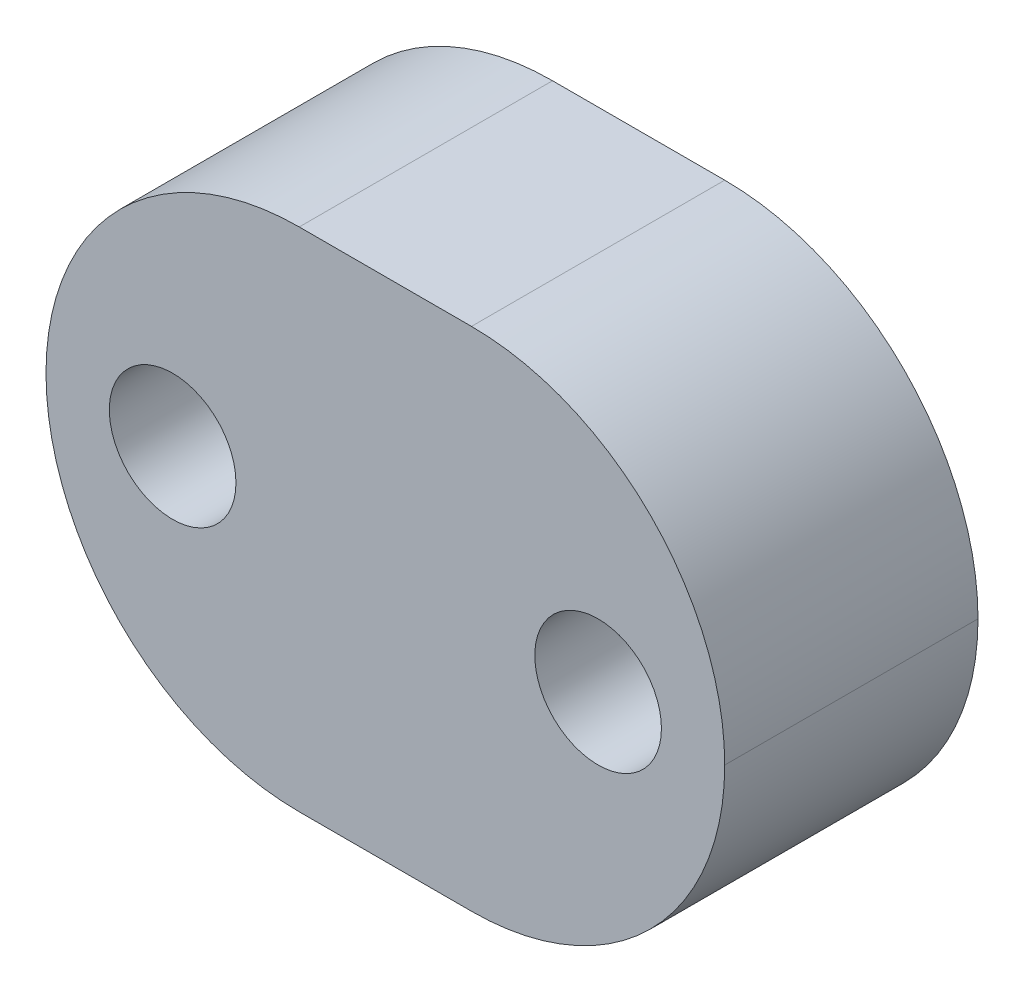
from build123d import *

# Parameters (mm, degrees)
SKETCH1_W           = 26.8
SKETCH1_H           = 20
SKETCH1_R           = 2.5
BOSS_EXTRUDE1_DEPTH = 10
FILLET1_R           = 10


with BuildPart() as part:
    # Sketch1 → Boss-Extrude1 (new body)
    with BuildSketch(Plane.XY):
        Rectangle(SKETCH1_W, SKETCH1_H)
        with Locations((-8.4, 0)):
            Circle(SKETCH1_R, mode=Mode.SUBTRACT)
        with Locations((8.4, 0)):
            Circle(SKETCH1_R, mode=Mode.SUBTRACT)
    extrude(amount=BOSS_EXTRUDE1_DEPTH)

    # Fillet1
    fillet1_edges = [part.edges().sort_by_distance(p)[0] for p in [
        (13.4, -10, 5),
        (13.4, 10, 5),
        (-13.4, -10, 5),
        (-13.4, 10, 5),
    ]]
    fillet(fillet1_edges, radius=FILLET1_R - 0.0001)  # a hair under: the kernel refuses the full size


solid = part.part
